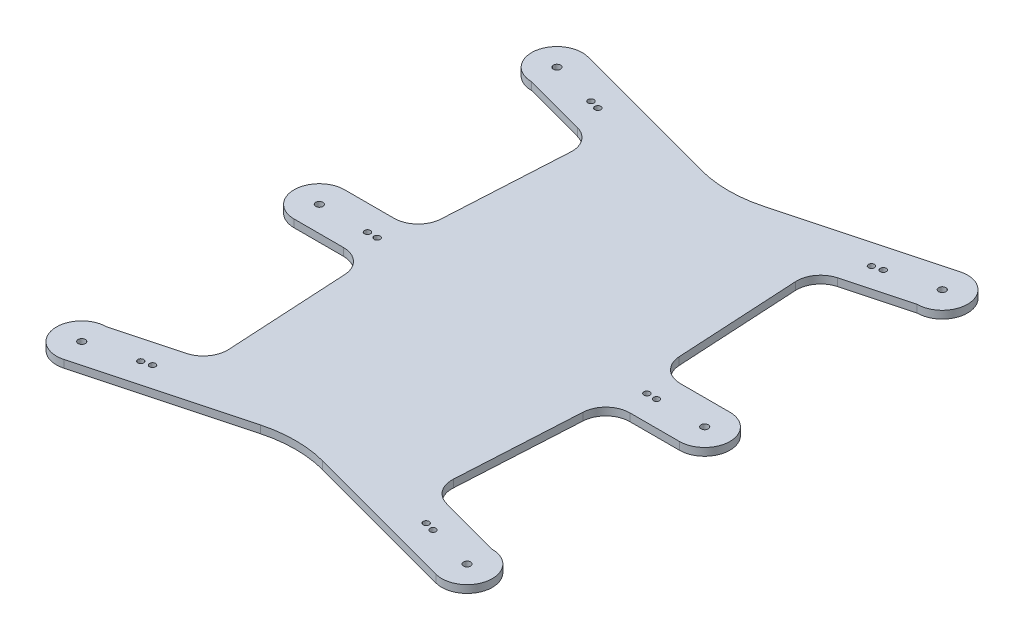
from build123d import *

# Parameters (mm, degrees)
SKETCH1_R           = 1.5
BOSS_EXTRUDE1_DEPTH = 3.175
CUT_EXTRUDE1_DEPTH  = 142.82756039
FILLET1_R           = 50
FILLET2_R           = 10


with BuildPart() as part:
    # Sketch1 → Boss-Extrude1 (new body)
    with BuildSketch(Plane(origin=(0, 0, 0), x_dir=(1, 0, 0), z_dir=(0, 1, 0))):
        with BuildLine():
            Line((-80, 10.5), (-50, 10.5))
            Line((-50, 10.5), (-46.19259608, 79.095931406))
            Line((-46.19259608, 79.095931406), (-80, 88.154597985))
            ThreePointArc((-80, 88.154597985), (-90.410171044, 100.025123003), (-77.282400026, 108.796819161))
            Line((-77.282400026, 108.796819161), (0, 88.089062485))
            Line((0, 88.089062485), (77.282400026, 108.796819161))
            ThreePointArc((77.282400026, 108.796819161), (90.410171044, 100.025123003), (80, 88.154597985))
            Line((80, 88.154597985), (46.19259608, 79.095931406))
            Line((46.19259608, 79.095931406), (50, 10.5))
            Line((50, 10.5), (80, 10.5))
            ThreePointArc((80, 10.5), (90.5, 0), (80, -10.5))
            Line((80, -10.5), (50, -10.5))
            Line((50, -10.5), (46.19259608, -79.095931406))
            Line((46.19259608, -79.095931406), (80, -88.154597985))
            ThreePointArc((80, -88.154597985), (90.410171044, -100.025123003), (77.282400026, -108.796819161))
            Line((77.282400026, -108.796819161), (0, -88.089062485))
            Line((0, -88.089062485), (-77.282400026, -108.796819161))
            ThreePointArc((-77.282400026, -108.796819161), (-90.410171044, -100.025123003), (-80, -88.154597985))
            Line((-80, -88.154597985), (-46.19259608, -79.095931406))
            Line((-46.19259608, -79.095931406), (-50, -10.5))
            Line((-50, -10.5), (-80, -10.5))
            ThreePointArc((-80, -10.5), (-90.5, 0), (-80, 10.5))
        make_face()
        with Locations((-80, 98.654597985)):
            Circle(SKETCH1_R, mode=Mode.SUBTRACT)
        with Locations((-80, 0)):
            Circle(SKETCH1_R, mode=Mode.SUBTRACT)
        with Locations((80, 0)):
            Circle(SKETCH1_R, mode=Mode.SUBTRACT)
        with Locations((80, 98.654597985)):
            Circle(SKETCH1_R, mode=Mode.SUBTRACT)
        with Locations((80, -98.654597985)):
            Circle(SKETCH1_R, mode=Mode.SUBTRACT)
        with Locations((-80, -98.654597985)):
            Circle(SKETCH1_R, mode=Mode.SUBTRACT)
    extrude(amount=BOSS_EXTRUDE1_DEPTH)

    # Sketch2 → Cut-Extrude1 (cut, through all)
    with BuildSketch(Plane(origin=(0, 3.175, 0), x_dir=(1, 0, 0), z_dir=(0, 1, 0))):
        with BuildLine():
            ThreePointArc((55.610372886, -92.119417096), (56.494256363, -93.650348185), (58.025187452, -92.766464709))
            ThreePointArc((58.025187452, -92.766464709), (57.141303975, -91.23553362), (55.610372886, -92.119417096))
        make_face()
        with BuildLine():
            ThreePointArc((61.888890757, -93.801740889), (61.005007281, -92.2708098), (59.474076191, -93.154693277))
            ThreePointArc((59.474076191, -93.154693277), (60.357959668, -94.685624366), (61.888890757, -93.801740889))
        make_face()
        with BuildLine():
            ThreePointArc((54.75, 0), (56, -1.25), (57.25, 0))
            ThreePointArc((57.25, 0), (56, 1.25), (54.75, 0))
        make_face()
        with BuildLine():
            ThreePointArc((61.25, 0), (60, 1.25), (58.75, 0))
            ThreePointArc((58.75, 0), (60, -1.25), (61.25, 0))
        make_face()
        with BuildLine():
            ThreePointArc((58.025187452, 92.766464709), (56.494256363, 93.650348185), (55.610372886, 92.119417096))
            ThreePointArc((55.610372886, 92.119417096), (57.141303975, 91.23553362), (58.025187452, 92.766464709))
        make_face()
        with BuildLine():
            ThreePointArc((61.888890757, 93.801740889), (60.357959668, 94.685624366), (59.474076191, 93.154693277))
            ThreePointArc((59.474076191, 93.154693277), (61.005007281, 92.2708098), (61.888890757, 93.801740889))
        make_face()
        with BuildLine():
            ThreePointArc((-59.474076191, 93.154693277), (-60.357959668, 94.685624366), (-61.888890757, 93.801740889))
            ThreePointArc((-61.888890757, 93.801740889), (-61.005007281, 92.2708098), (-59.474076191, 93.154693277))
        make_face()
        with BuildLine():
            ThreePointArc((-58.025187452, 92.766464709), (-57.141303975, 91.23553362), (-55.610372886, 92.119417096))
            ThreePointArc((-55.610372886, 92.119417096), (-56.494256363, 93.650348185), (-58.025187452, 92.766464709))
        make_face()
        with BuildLine():
            ThreePointArc((-58.75, 0), (-60, 1.25), (-61.25, 0))
            ThreePointArc((-61.25, 0), (-60, -1.25), (-58.75, 0))
        make_face()
        with BuildLine():
            ThreePointArc((-57.25, 0), (-56, -1.25), (-54.75, 0))
            ThreePointArc((-54.75, 0), (-56, 1.25), (-57.25, 0))
        make_face()
        with BuildLine():
            ThreePointArc((-58.025187452, -92.766464709), (-56.494256363, -93.650348185), (-55.610372886, -92.119417096))
            ThreePointArc((-55.610372886, -92.119417096), (-57.141303975, -91.23553362), (-58.025187452, -92.766464709))
        make_face()
        with BuildLine():
            ThreePointArc((-59.474076191, -93.154693277), (-61.005007281, -92.2708098), (-61.888890757, -93.801740889))
            ThreePointArc((-61.888890757, -93.801740889), (-60.357959668, -94.685624366), (-59.474076191, -93.154693277))
        make_face()
    extrude(amount=-CUT_EXTRUDE1_DEPTH, mode=Mode.SUBTRACT)

    # Fillet1
    fillet1_edges = [part.edges().sort_by_distance(p)[0] for p in [
        (0, 1.5875, -88.089062485),
        (0, 1.5875, 88.089062485),
    ]]
    fillet(fillet1_edges, radius=FILLET1_R)

    # Fillet2
    fillet2_edges = [part.edges().sort_by_distance(p)[0] for p in [
        (46.19259608, 1.5875, 79.095931406),
        (50, 1.5875, 10.5),
        (50, 1.5875, -10.5),
        (46.19259608, 1.5875, -79.095931406),
        (-46.19259608, 1.5875, -79.095931406),
        (-50, 1.5875, -10.5),
        (-50, 1.5875, 10.5),
        (-46.19259608, 1.5875, 79.095931406),
    ]]
    fillet(fillet2_edges, radius=FILLET2_R)


solid = part.part
